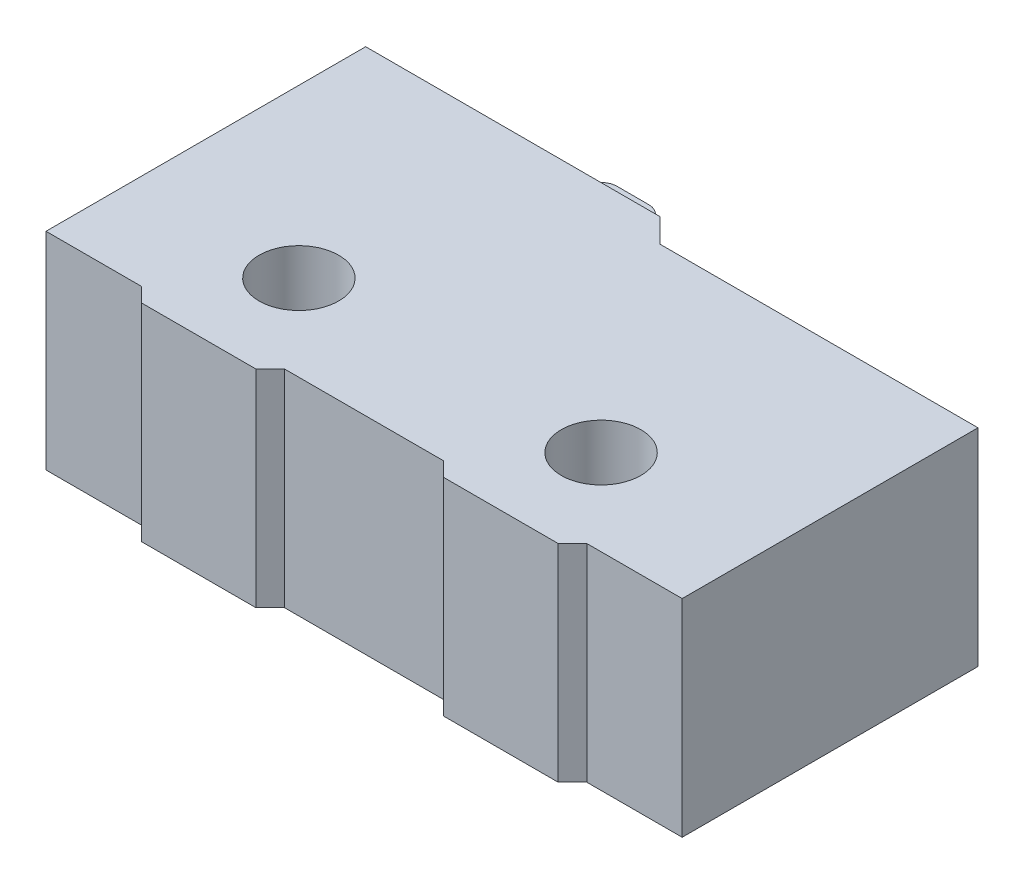
from build123d import *

# Parameters (mm, degrees)
SKETCH_1_W          = 20
SKETCH_1_H          = 10.5
EXTRUDE_1_DEPTH     = 6.5
SKETCH_2_R          = 1.25
CUT_EXTRUDE_1_DEPTH = 6.5
SKETCH_3_W          = 4.44626532
SKETCH_3_H          = 1.008872475
SKETCH_3_W_2        = 5
SKETCH_3_W_3        = 3.65317203
CUT_EXTRUDE_2_DEPTH = 6.5
CHAMFER_1_SIZE      = 0.45
SKETCH_4_W          = 10.31021277
SKETCH_4_H          = 1.008783122
CUT_EXTRUDE_3_DEPTH = 6.5
CHAMFER_2_SIZE      = 0.75
SKETCH_5_W          = 2
SKETCH_5_H          = 1.4
EXTRUDE_2_DEPTH     = 4
FILLET_1_R          = 0.5


with BuildPart() as part:
    # 스케치1 → 보스-돌출1 (new body)
    with BuildSketch(Plane(origin=(0, 0, 0), x_dir=(1, 0, 0), z_dir=(0, 1, 0))):
        Rectangle(SKETCH_1_W, SKETCH_1_H)
    extrude(amount=EXTRUDE_1_DEPTH)

    # 스케치2 → 컷-돌출1 (cut)
    with BuildSketch(Plane(origin=(0, 6.5, 0), x_dir=(1, 0, 0), z_dir=(0, 1, 0))):
        with Locations(Location((-4.75, -2.1, 0), (0, 0, 270))):
            Circle(SKETCH_2_R)
        with Locations(Location((4.75, -2.1, 0), (0, 0, 270))):
            Circle(SKETCH_2_R)
    extrude(amount=-CUT_EXTRUDE_1_DEPTH, mode=Mode.SUBTRACT)

    # 스케치3 → 컷-돌출2 (cut)
    with BuildSketch(Plane(origin=(0, 6.5, 0), x_dir=(1, 0, 0), z_dir=(0, 1, 0))):
        with Locations((-9.22313266, -5.304436238)):
            Rectangle(SKETCH_3_W, SKETCH_3_H)
        with Locations((0, -5.304436238)):
            Rectangle(SKETCH_3_W_2, SKETCH_3_H)
        with Locations((8.826586015, -5.304436238)):
            Rectangle(SKETCH_3_W_3, SKETCH_3_H)
    extrude(amount=-CUT_EXTRUDE_2_DEPTH, mode=Mode.SUBTRACT)

    # 모따기1
    chamfer_1_edges = [part.edges().sort_by_distance(p)[0] for p in [
        (7, 3.25, 5.25),
        (2.5, 3.25, 5.25),
        (-2.5, 3.25, 5.25),
        (-7, 3.25, 5.25),
    ]]
    chamfer(chamfer_1_edges, length=CHAMFER_1_SIZE - 0.0001)  # a hair under: the kernel refuses the full size

    # 스케치4 → 컷-돌출3 (cut)
    with BuildSketch(Plane(origin=(0, 6.5, 0), x_dir=(1, 0, 0), z_dir=(0, 1, 0))):
        with Locations((5.155106385, 5.004391561)):
            Rectangle(SKETCH_4_W, SKETCH_4_H)
    extrude(amount=-CUT_EXTRUDE_3_DEPTH, mode=Mode.SUBTRACT)

    # 모따기2
    chamfer_2_edges = [part.edges().sort_by_distance(p)[0] for p in [
        (0, 3.25, -5.25),
    ]]
    chamfer(chamfer_2_edges, length=CHAMFER_2_SIZE - 0.0001)  # a hair under: the kernel refuses the full size

    # 스케치5 → 보스-돌출2 (add)
    with BuildSketch(Plane(origin=(0, 5.25, 0), x_dir=(1, 0, 0), z_dir=(0, 1, 0))):
        with Locations((-3, 5.95)):
            Rectangle(SKETCH_5_W, SKETCH_5_H)
    extrude(amount=-EXTRUDE_2_DEPTH)

    # 필렛1
    fillet_1_edges = [part.edges().sort_by_distance(p)[0] for p in [
        (-4, 3.25, -6.65),
        (-2, 3.25, -6.65),
    ]]
    fillet(fillet_1_edges, radius=FILLET_1_R)


solid = part.part
